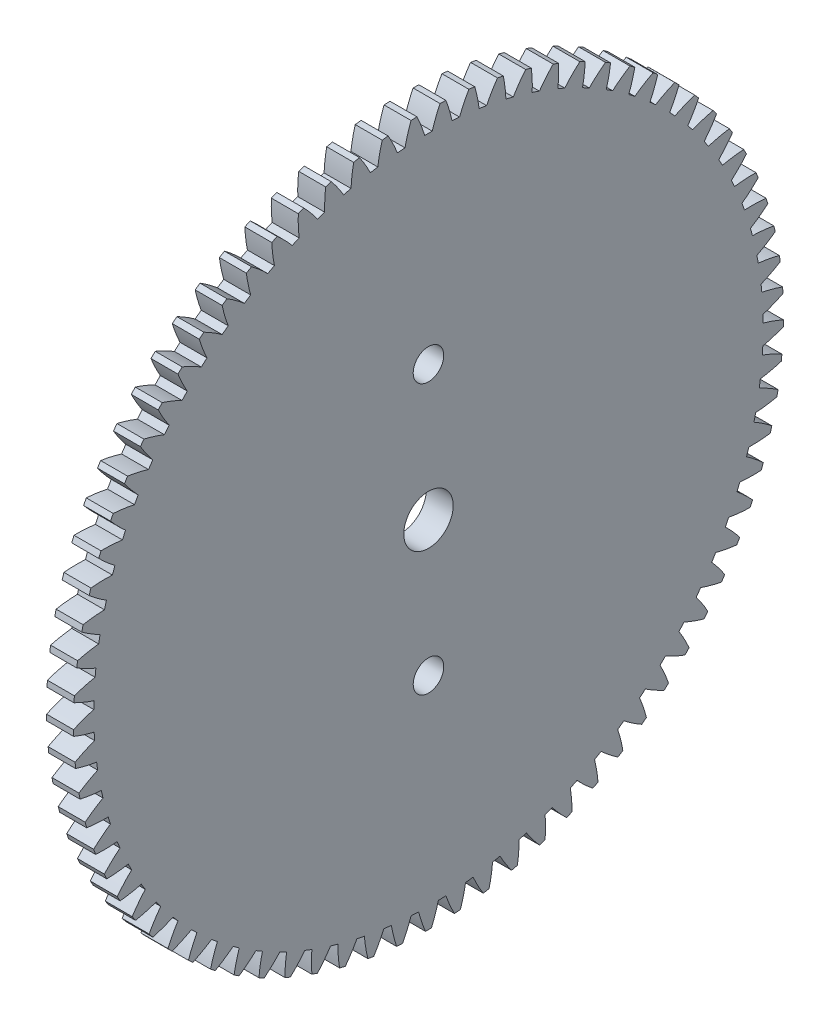
from build123d import *

# Parameters (mm, degrees)
BASPROSKE_W     = 2
BASPROSKE_H     = 39.5
TOOTHCUT_DEPTH  = 56.897227123
TEETHCUTS_COUNT = 77
TEETHCUTS_ANGLE = 355.324675325
BORSKE_R        = 2.75
BORSKE_R_2      = 1.7
BORE_DEPTH      = 50.0000508
SCALE1_SCALE_X  = 1.5
SCALE1_SCALE_Y  = 1
SCALE1_SCALE_Z  = 1


with BuildPart() as part:
    # BasProSke → Base-Revolve (revolve)
    with BuildSketch(Plane(origin=(0, 0, 0), x_dir=(1, 0, 0), z_dir=(0, 1, 0))):
        with Locations((1, 19.75)):
            Rectangle(BASPROSKE_W, BASPROSKE_H)
    revolve(axis=Axis((-10, 0, 0), (1, 0, 0)))

    # TooCutSke → ToothCut (cut, through all)
    with BuildSketch(Plane(origin=(0, 0, 0), x_dir=(0, 0, -1), z_dir=(1, 0, 0))):
        with BuildLine():
            ThreePointArc((0.421689506, 37.246612986), (0, 37.249), (-0.421689506, 37.246612986))
            ThreePointArc((-0.421689506, 37.246612986), (-0.813577504, 38.392577583), (-1.294307305, 39.504202482))
            ThreePointArc((-1.294307305, 39.504202482), (0, 39.5254), (1.294307305, 39.504202482))
            ThreePointArc((1.294307305, 39.504202482), (0.813577504, 38.392577583), (0.421689506, 37.246612986))
        make_face()
    toothcut = extrude(amount=TOOTHCUT_DEPTH, mode=Mode.SUBTRACT)

    # TeethCuts: ToothCut ×77 about axis
    teethcuts_axis = Axis((-10, 0, 0), (1, 0, 0))
    for i in range(1, TEETHCUTS_COUNT):
        add(toothcut.rotate(teethcuts_axis, i * TEETHCUTS_ANGLE / (TEETHCUTS_COUNT - 1)), mode=Mode.SUBTRACT)

    # BorSke → Bore (cut, symmetric)
    with BuildSketch(Plane(origin=(0, 0, 0), x_dir=(0, 0, -1), z_dir=(1, 0, 0))):
        Circle(BORSKE_R)
        with Locations((0, -15)):
            Circle(BORSKE_R_2)
        with Locations((0, 15)):
            Circle(BORSKE_R_2)
    extrude(amount=BORE_DEPTH, both=True, mode=Mode.SUBTRACT)


with BuildPart() as part_1:
    # Scale1: scaled about (1, 0, 0)
    add(part.part.scale((SCALE1_SCALE_X, SCALE1_SCALE_Y, SCALE1_SCALE_Z), about=(1, 0, 0)))


solid = part_1.part
